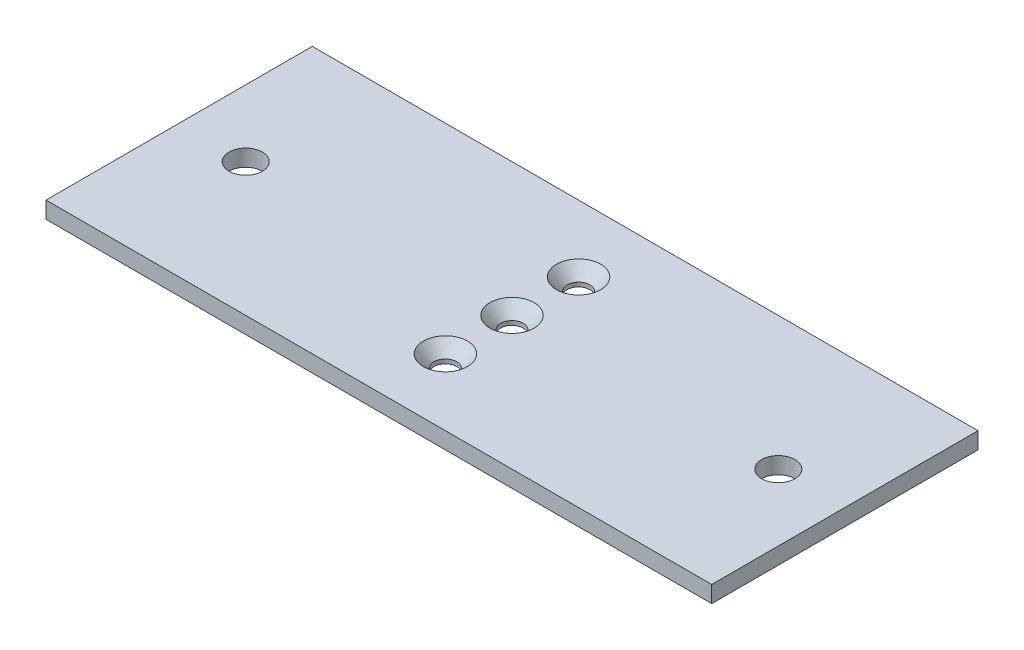
from build123d import *

# Parameters (mm, degrees)
SKETCH1_W                                     = 127
SKETCH1_H                                     = 50.8
BOSS_EXTRUDE1_DEPTH                           = 3.175
SKETCH2_R                                     = 3.175
CUT_EXTRUDE1_DEPTH                            = 6.35
CSK_FOR_8_FLAT_HEAD_MACHINE_SCREW1_AT_2_COUNT = 2
CSK_FOR_8_FLAT_HEAD_MACHINE_SCREW1_AT_2_PITCH = 12.7
CSK_FOR_8_FLAT_HEAD_MACHINE_SCREW1_AT_3_COUNT = 2
CSK_FOR_8_FLAT_HEAD_MACHINE_SCREW1_AT_3_PITCH = 25.4


with BuildPart() as part:
    # Sketch1 → Boss-Extrude1 (new body)
    with BuildSketch(Plane(origin=(0, 0, 0), x_dir=(1, 0, 0), z_dir=(0, 1, 0))):
        with Locations((63.5, 25.4)):
            Rectangle(SKETCH1_W, SKETCH1_H)
    extrude(amount=BOSS_EXTRUDE1_DEPTH)

    # Sketch2 → Cut-Extrude1 (cut)
    with BuildSketch(Plane(origin=(0, 3.175, 0), x_dir=(1, 0, 0), z_dir=(0, 1, 0))):
        with Locations((12.7, 25.4)):
            Circle(SKETCH2_R)
        with Locations((114.3, 25.4)):
            Circle(SKETCH2_R)
    extrude(amount=-CUT_EXTRUDE1_DEPTH, mode=Mode.SUBTRACT)

    # Sketch4 → CSK for #8 Flat Head Machine Screw1 (revolve, cut)
    with BuildSketch(Plane(origin=(63.5, 3.175, -12.7), x_dir=(0, 0, 1), z_dir=(1, 0, 0))):
        Polygon((0, 0), (0, 3.175), (2.15265, 3.175), (2.15265, 2.3740728), (4.2164, 0), align=None)
    csk_for_8_flat_head_machine_screw1 = revolve(axis=Axis((63.5, 9.525, -12.7), (0, -1, 0)), mode=Mode.SUBTRACT)

    # CSK for #8 Flat Head Machine Screw1 at 2: CSK for #8 Flat Head Machine Screw1 ×2
    with Locations(*[(0, 0, -i * CSK_FOR_8_FLAT_HEAD_MACHINE_SCREW1_AT_2_PITCH) for i in range(1, CSK_FOR_8_FLAT_HEAD_MACHINE_SCREW1_AT_2_COUNT)]):
        add(csk_for_8_flat_head_machine_screw1, mode=Mode.SUBTRACT)

    # CSK for #8 Flat Head Machine Screw1 at 3: CSK for #8 Flat Head Machine Screw1 ×2
    with Locations(*[(0, 0, -i * CSK_FOR_8_FLAT_HEAD_MACHINE_SCREW1_AT_3_PITCH) for i in range(1, CSK_FOR_8_FLAT_HEAD_MACHINE_SCREW1_AT_3_COUNT)]):
        add(csk_for_8_flat_head_machine_screw1, mode=Mode.SUBTRACT)


solid = part.part
